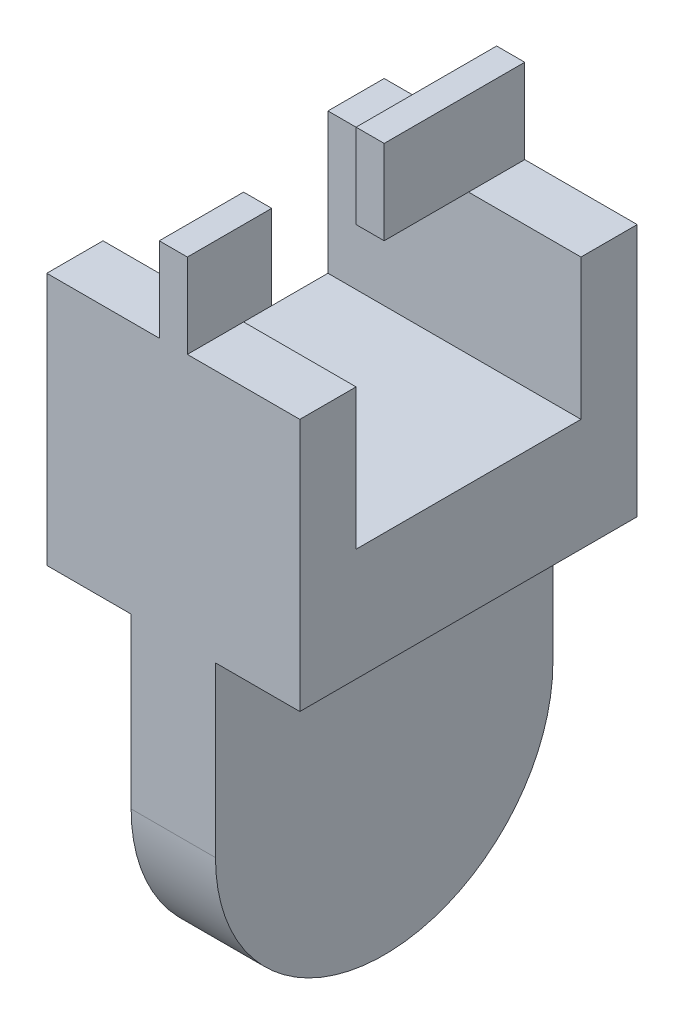
from build123d import *

# Parameters (mm, degrees)
BOSS_EXTRUDE1_DEPTH = 112.5
SKETCH2_W           = 75
SKETCH2_H           = 300
SKETCH2_W_2         = 100
SKETCH2_H_2         = 75
CUT_EXTRUDE2_DEPTH  = 553.40949485


with BuildPart() as part:
    # Sketch1 → Boss-Extrude1 (new body)
    with BuildSketch(Plane.YZ):
        with BuildLine():
            Line((0, 150), (450, 150))
            Line((450, 150), (450, 75))
            Line((450, 75), (375, 75))
            Line((375, 75), (375, 100))
            Line((375, 100), (250, 100))
            Line((250, 100), (250, -100))
            Line((250, -100), (375, -100))
            Line((375, -100), (375, -25))
            Line((375, -25), (450, -25))
            Line((450, -25), (450, -150))
            Line((450, -150), (0, -150))
            ThreePointArc((0, -150), (-150, 0), (0, 150))
        make_face()
    extrude(amount=BOSS_EXTRUDE1_DEPTH)

    # Mirror1: part across plane


with BuildPart() as part_1:
    add(part.part)
    add(part.part.mirror(Plane(origin=(0, 0, 0), x_dir=(0, 0, 1), z_dir=(1, 0, 0))))

    # Sketch2 → Cut-Extrude2 (cut, through all)
    with BuildSketch(Plane.XY.offset(150)):
        with Locations((75, 0)):
            Rectangle(SKETCH2_W, SKETCH2_H)
        with Locations((62.5, 412.5)):
            Rectangle(SKETCH2_W_2, SKETCH2_H_2)
        with Locations((-75, 0)):
            Rectangle(SKETCH2_W, SKETCH2_H)
        with Locations((-62.5, 412.5)):
            Rectangle(SKETCH2_W_2, SKETCH2_H_2)
    extrude(amount=-CUT_EXTRUDE2_DEPTH, mode=Mode.SUBTRACT)


solid = part_1.part
